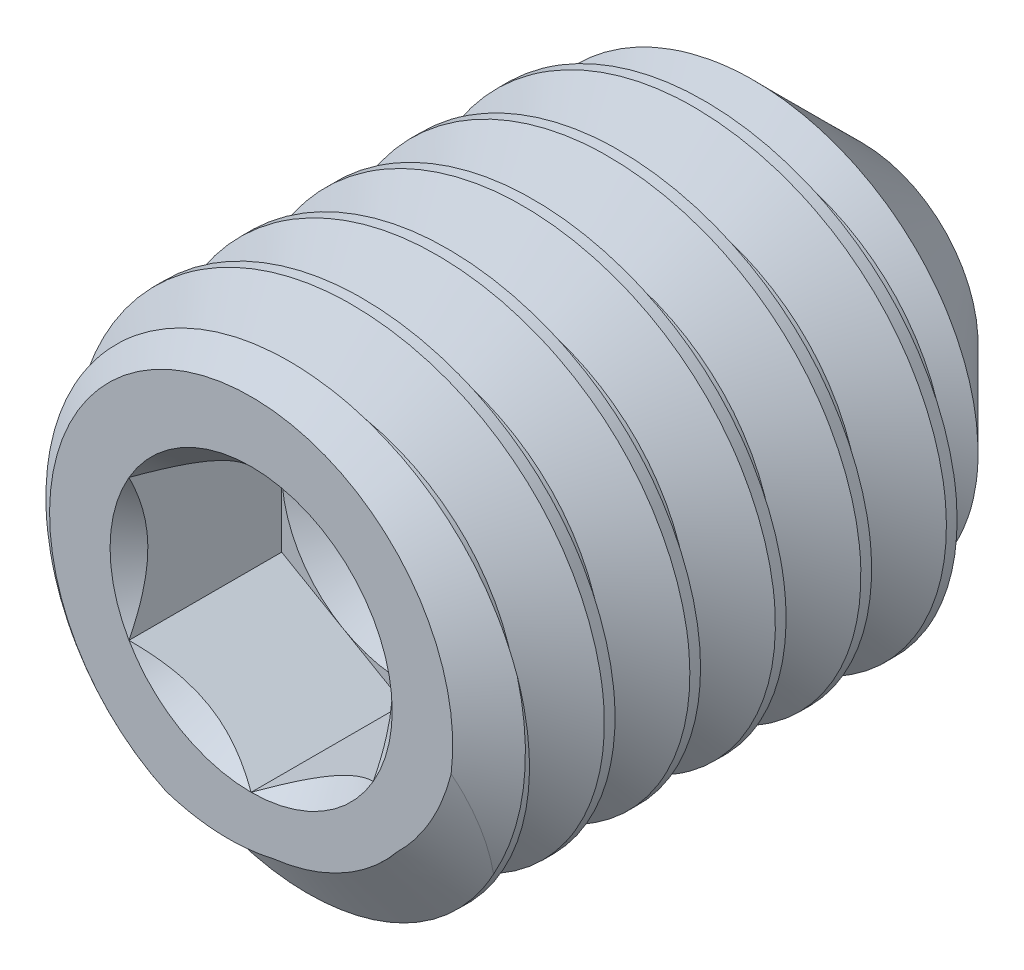
from build123d import *

# Parameters (mm, degrees)
CUT_EXTRUDE1_DEPTH = 1.25
CUT_SWEEP1_PITCH   = 0.7


with BuildPart() as part:
    # Sketch11 → Revolve1 (revolve)
    with BuildSketch(Plane(origin=(0, 0, 0), x_dir=(0, 0, -1), z_dir=(1, 0, 0)), mode=Mode.PRIVATE) as revolve1_sk:
        Polygon((-2.5, 0), (-2.5, 1.65), (-2.254927362, 2), (1.45, 2), (2.5, 0.95), (1.929182412, 0), align=None)
    revolve(revolve1_sk.sketch.rotate(Axis((0, 0, -1.929182412), (0, 0, -1)), 180), axis=Axis((0, 0, -1.929182412), (0, 0, -1)))

    # Sketch2 → Cut-Extrude1 (cut)
    with BuildSketch(Plane.XY.offset(2.5)):
        Polygon((0, 1.154700538), (-1, 0.577350269), (-1, -0.577350269), (0, -1.154700538), (1, -0.577350269), (1, 0.577350269), align=None)
    extrude(amount=-CUT_EXTRUDE1_DEPTH, mode=Mode.SUBTRACT)

    # Cut-Extrude2 cone 1 section (through the dimple's axis) → Cut-Extrude2 (revolve, cut)
    with BuildSketch(Plane(origin=(0, 0, 2.5), x_dir=(0, -1, 0), z_dir=(1, 0, 0))):
        Polygon((0, 0), (1.154700538, 0), (0, 1.154700538), align=None)
    revolve(axis=Axis((0, 0, 2.5), (0, 0, -1)), mode=Mode.SUBTRACT)

    # Cut-Extrude3 cone 1 section (through the dimple's axis) → Cut-Extrude3 (revolve, cut)
    with BuildSketch(Plane(origin=(0, 0, 1.25), x_dir=(0, -1, 0), z_dir=(1, 0, 0))):
        Polygon((0, 0), (1, 0), (0, 0.577350269), align=None)
    revolve(axis=Axis((0, 0, 1.25), (0, 0, -1)), mode=Mode.SUBTRACT)

    # Cut-Sweep1: the profile of Sketch6 screwed along a right-hand helix of 7.857143 turns, 6 arcs to a turn; built about Z, then put on its axis
    cut_sweep1_z = Axis((0, 0, 0), (0, 0, 1))
    cut_sweep1_corners = [(1.545336663, 0, -0.2625), (2.037888611, 0, 0.021875), (2.037888611, 0, -0.634375), (1.545336663, 0, -0.35)]
    with BuildLine(mode=Mode.PRIVATE) as cut_sweep1_profile:
        Line(cut_sweep1_corners[0], cut_sweep1_corners[1])
        Line(cut_sweep1_corners[1], cut_sweep1_corners[2])
        Line(cut_sweep1_corners[2], cut_sweep1_corners[3])
        Line(cut_sweep1_corners[3], cut_sweep1_corners[0])
    cut_sweep1_cap = Face(cut_sweep1_profile.wire())
    cut_sweep1_turn_angles = [0, 30, 60, 90, 120, 150, 180, 210, 240, 270, 300, 330, 360]
    cut_sweep1_turn_weights = [1, 0.8660254037844387, 1, 0.8660254037844387, 1, 0.8660254037844387, 1, 0.8660254037844387, 1, 0.8660254037844387, 1, 0.8660254037844387, 1]
    cut_sweep1_turn_rails = [Edge.make_bspline([Vector(p[0], p[1], 0).rotate(cut_sweep1_z, cut_sweep1_turn_angles[k]) / cut_sweep1_turn_weights[k] + Vector(0, 0, p[2] + CUT_SWEEP1_PITCH * cut_sweep1_turn_angles[k] / 360) for k in range(13)], [0, 0, 0, 1, 1, 2, 2, 3, 3, 4, 4, 5, 5, 6, 6, 6], 2, cut_sweep1_turn_weights) for p in cut_sweep1_corners]
    cut_sweep1_turn_sides = [Face.make_surface_from_curves(cut_sweep1_turn_rails[p[0]], cut_sweep1_turn_rails[p[1]]) for p in [(0, 1), (1, 2), (2, 3), (3, 0)]]
    cut_sweep1_last_angles = [2520, 2550, 2580, 2610, 2640, 2670, 2700, 2730, 2760, 2790, 2820, 2824.285714286, 2828.571428571]
    cut_sweep1_last_weights = [1, 0.8660254037844387, 1, 0.8660254037844387, 1, 0.8660254037844387, 1, 0.8660254037844387, 1, 0.8660254037844387, 1, 0.9972037971811684, 1]
    cut_sweep1_last_rails = [Edge.make_bspline([Vector(p[0], p[1], 0).rotate(cut_sweep1_z, cut_sweep1_last_angles[k]) / cut_sweep1_last_weights[k] + Vector(0, 0, p[2] + CUT_SWEEP1_PITCH * cut_sweep1_last_angles[k] / 360) for k in range(13)], [0, 0, 0, 1, 1, 2, 2, 3, 3, 4, 4, 5, 5, 6, 6, 6], 2, cut_sweep1_last_weights) for p in cut_sweep1_corners]
    cut_sweep1_last_sides = [Face.make_surface_from_curves(cut_sweep1_last_rails[p[0]], cut_sweep1_last_rails[p[1]]) for p in [(0, 1), (1, 2), (2, 3), (3, 0)]]
    cut_sweep1 = Plane(origin=(0, 0, -2.5), x_dir=(0, 1, 0), z_dir=(0, 0, 1)) * Solid(Shell([*[p.moved(Location((0, 0, CUT_SWEEP1_PITCH * i))) for i in range(7) for p in cut_sweep1_turn_sides], *cut_sweep1_last_sides, cut_sweep1_cap, cut_sweep1_cap.rotate(cut_sweep1_z, 2828.571428571).moved(Location((0, 0, CUT_SWEEP1_PITCH * 2828.571428571 / 360)))]))
    add(cut_sweep1, mode=Mode.SUBTRACT)


solid = part.part
